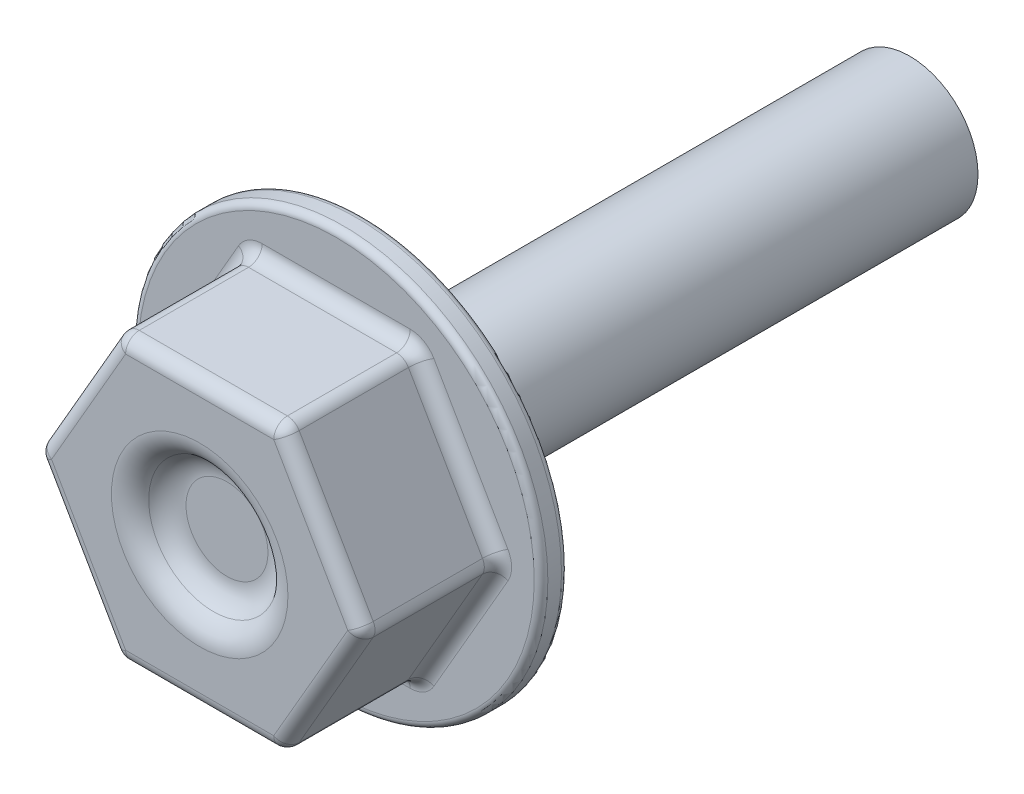
from build123d import *

# Parameters (mm, degrees)
SKETCH1_R           = 5
BOSS_EXTRUDE1_DEPTH = 40
SKETCH1_3_R         = 15
BOSS_EXTRUDE2_DEPTH = 2
BOSS_EXTRUDE3_DEPTH = 10
CUT_EXTRUDE1_START  = 10
SKETCH2_3_R         = 5
CUT_EXTRUDE1_DEPTH  = 2
FILLET1_R           = 0.5
FILLET2_R           = 1
FILLET3_R           = 2
FILLET4_R           = 2
SCALE1_SCALE        = 0.875


with BuildPart() as part:
    # Sketch1 → Boss-Extrude1 (new body)
    with BuildSketch(Plane(origin=(0, 0, 0), x_dir=(0, 1, 0), z_dir=(0, 0, 1))):
        with Locations(Location((0, 0, 0), (0, 0, 270))):
            Circle(SKETCH1_R)
    extrude(amount=-BOSS_EXTRUDE1_DEPTH)

    # Sketch1<3> → Boss-Extrude2 (add)
    with BuildSketch(Plane(origin=(0, 0, 0), x_dir=(0, 1, 0), z_dir=(0, 0, 1))):
        with Locations(Location((0, 0, 0), (0, 0, 270))):
            Circle(SKETCH1_3_R)
    extrude(amount=BOSS_EXTRUDE2_DEPTH)

    # Sketch2 → Boss-Extrude3 (add)
    with BuildSketch(Plane.XY.offset(2)):
        Polygon((-12, 0), (-6, -10.392304845), (6, -10.392304845), (12, 0), (6, 10.392304845), (-6, 10.392304845), align=None)
    extrude(amount=BOSS_EXTRUDE3_DEPTH)

    # Sketch2<3> → Cut-Extrude1 (cut)
    with BuildSketch(Plane.XY.offset(2).offset(CUT_EXTRUDE1_START)):
        Circle(SKETCH2_3_R)
    extrude(amount=-CUT_EXTRUDE1_DEPTH, mode=Mode.SUBTRACT)

    # Fillet1
    fillet1_edges = [part.edges().sort_by_distance(p)[0] for p in [
        (-15, 0, 0),
        (-15, 0, 2),
    ]]
    fillet(fillet1_edges, radius=FILLET1_R)

    # Fillet2
    fillet2_edges = [part.edges().sort_by_distance(p)[0] for p in [
        (0, -10.392304845, 2),
        (-6, -10.392304845, 7),
        (9, -5.196152423, 2),
        (6, -10.392304845, 7),
        (9, 5.196152423, 2),
        (12, 0, 7),
        (0, 10.392304845, 2),
        (6, 10.392304845, 7),
        (-9, 5.196152423, 2),
        (-6, 10.392304845, 7),
        (-9, -5.196152423, 2),
        (-12, 0, 7),
        (0, -10.392304845, 12),
        (9, -5.196152423, 12),
        (9, 5.196152423, 12),
        (0, 10.392304845, 12),
        (-9, 5.196152423, 12),
        (-9, -5.196152423, 12),
    ]]
    fillet(fillet2_edges, radius=FILLET2_R)

    # Fillet3
    fillet3_edges = [part.edges().sort_by_distance(p)[0] for p in [
        (-5, 0, 10),
    ]]
    fillet(fillet3_edges, radius=FILLET3_R - 0.0001)  # a hair under: the kernel refuses the full size

    # Fillet4
    fillet4_edges = [part.edges().sort_by_distance(p)[0] for p in [
        (-5, 0, 12),
    ]]
    fillet(fillet4_edges, radius=FILLET4_R)


with BuildPart() as part_1:
    # Scale1: scaled about (-9e-09, 0, -4.545352594)
    add(part.part.scale(SCALE1_SCALE).moved(Location((-1e-09, 0, -0.568169074))))


solid = part_1.part
